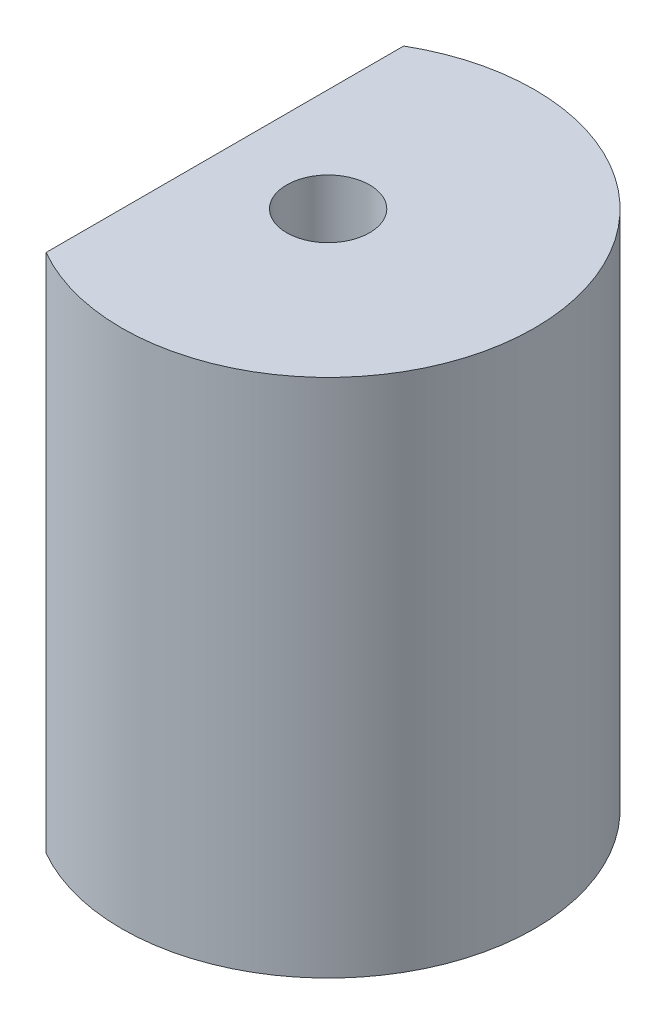
from build123d import *

# Parameters (mm, degrees)
SKETCH1_R                       = 12.7
BOSS_EXTRUDE1_DEPTH             = 32
TAP_DRILL_FOR_1_4_20_TAP1_D     = 5.1054
TAP_DRILL_FOR_1_4_20_TAP1_DEPTH = 10.16
TAP_DRILL_FOR_1_4_20_TAP1_TIP   = 1.533816902
TAP_DRILL_FOR_1_4_20_TAP2_D     = 5.1054
TAP_DRILL_FOR_1_4_20_TAP2_DEPTH = 10.16
TAP_DRILL_FOR_1_4_20_TAP2_TIP   = 1.533816902
CUT_EXTRUDE1_DEPTH              = 37.695776324


with BuildPart() as part:
    # Sketch1 → Boss-Extrude1 (new body)
    with BuildSketch(Plane(origin=(0, 0, 0), x_dir=(1, 0, 0), z_dir=(0, 1, 0))):
        Circle(SKETCH1_R)
    extrude(amount=BOSS_EXTRUDE1_DEPTH)

    # Tap Drill for 1/4-20 Tap1
    with Locations(Plane.XZ):
        with Locations((0, 0)):
            Hole(TAP_DRILL_FOR_1_4_20_TAP1_D / 2, depth=TAP_DRILL_FOR_1_4_20_TAP1_DEPTH)
            with Locations((0, 0, -(TAP_DRILL_FOR_1_4_20_TAP1_DEPTH + TAP_DRILL_FOR_1_4_20_TAP1_TIP / 2))):  # 118° drill point
                Cone(0, TAP_DRILL_FOR_1_4_20_TAP1_D / 2, TAP_DRILL_FOR_1_4_20_TAP1_TIP, mode=Mode.SUBTRACT)

    # Tap Drill for 1/4-20 Tap2
    with Locations(Plane(origin=(0, 32, 0), x_dir=(1, 0, 0), z_dir=(0, 1, 0))):
        with Locations((0, 0)):
            Hole(TAP_DRILL_FOR_1_4_20_TAP2_D / 2, depth=TAP_DRILL_FOR_1_4_20_TAP2_DEPTH)
            with Locations((0, 0, -(TAP_DRILL_FOR_1_4_20_TAP2_DEPTH + TAP_DRILL_FOR_1_4_20_TAP2_TIP / 2))):  # 118° drill point
                Cone(0, TAP_DRILL_FOR_1_4_20_TAP2_D / 2, TAP_DRILL_FOR_1_4_20_TAP2_TIP, mode=Mode.SUBTRACT)

    # Sketch6 → Cut-Extrude1 (cut, through all)
    with BuildSketch(Plane(origin=(0, 32, 0), x_dir=(1, 0, 0), z_dir=(0, 1, 0))):
        with BuildLine():
            Line((-6.35, 10.998522628), (-6.35, -10.998522628))
            ThreePointArc((-6.35, -10.998522628), (-12.7, 0), (-6.35, 10.998522628))
        make_face()
    extrude(amount=-CUT_EXTRUDE1_DEPTH, mode=Mode.SUBTRACT)


solid = part.part
